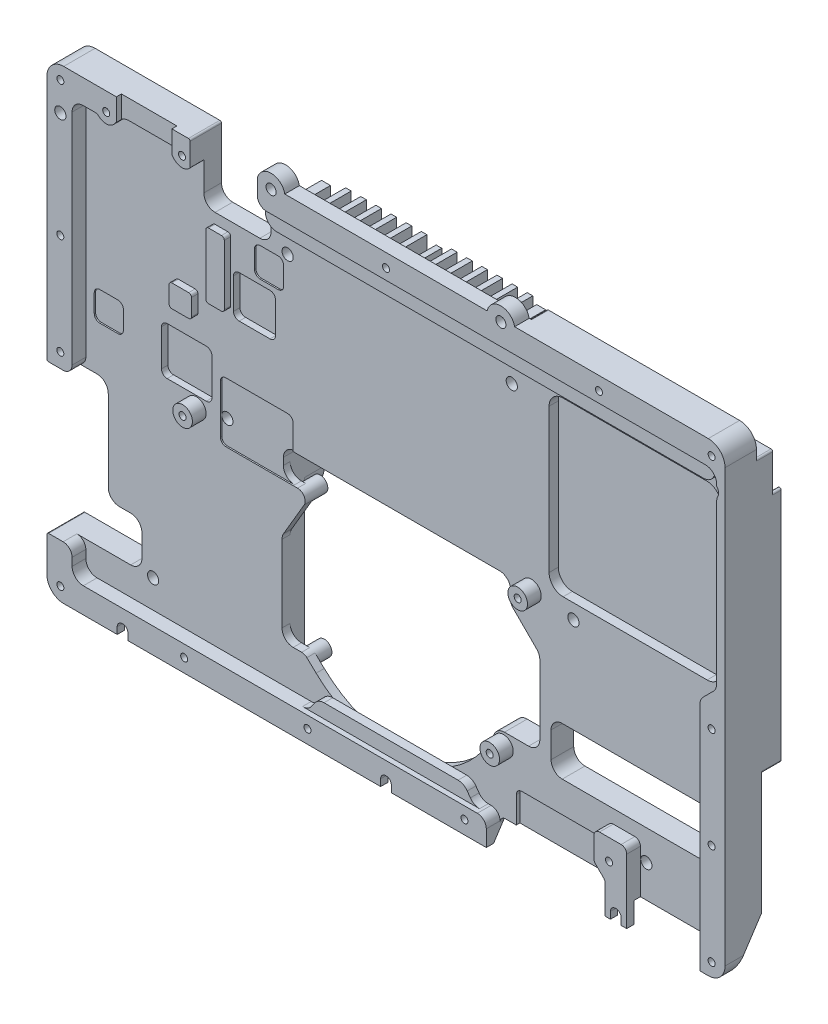
from build123d import *

# Parameters (mm, degrees)
SKIZZE1_W                                           = 121
SKIZZE1_H                                           = 83
AUFSATZ_LINEAR_AUSTRAGEN1_DEPTH                     = 6.5
SKIZZE33_W                                          = 121
SKIZZE33_H                                          = 53.5
AUFSATZ_LINEAR_AUSTRAGEN9_DEPTH                     = 10
SCHNITT_LINEAR_AUSTRAGEN2_DEPTH                     = 106.011915991
SKIZZE9_W                                           = 13.05
SKIZZE9_H                                           = 12.8
SKIZZE9_W_2                                         = 21.2
SKIZZE9_H_2                                         = 14.5
SCHNITT_LINEAR_AUSTRAGEN5_DEPTH                     = 106.011915991
SCHNITT_LINEAR_AUSTRAGEN3_DEPTH                     = 106.216443582
SCHNITT_LINEAR_AUSTRAGEN4_DEPTH                     = 106.011915991
SKIZZE10_W                                          = 9
SKIZZE10_H                                          = 8.5
SKIZZE10_W_2                                        = 7.5
SKIZZE10_H_2                                        = 7.5
SCHNITT_LINEAR_AUSTRAGEN6_DEPTH                     = 105.935504001
SKIZZE79_W                                          = 5.2
SKIZZE79_H                                          = 5.2
SKIZZE79_W_2                                        = 13
SKIZZE79_H_2                                        = 10.649070229
SCHNITT_LINEAR_AUSTRAGEN49_DEPTH                    = 105.994237937
SCHNITT_LINEAR_AUSTRAGEN8_DEPTH                     = 105.906196195
SKIZZE13_W                                          = 29
SKIZZE13_H                                          = 8.6
SCHNITT_LINEAR_AUSTRAGEN9_DEPTH                     = 106.216443582
AUFSATZ_LINEAR_AUSTRAGEN16_REACH                    = 107.216
SKIZZE63_R                                          = 1.85
SKIZZE16_W                                          = 9.9
SKIZZE16_H                                          = 11.306446957
SCHNITT_LINEAR_AUSTRAGEN12_DEPTH                    = 106.134723094
SCHNITT_LINEAR_AUSTRAGEN42_DEPTH                    = 106.011915991
SKIZZE69_W                                          = 1.7
SKIZZE69_H                                          = 8.511092418
SCHNITT_LINEAR_AUSTRAGEN48_DEPTH                    = 75.215497034
LINEARES_MUSTER1_COUNT                              = 7
LINEARES_MUSTER1_PITCH                              = 2.7
SCHNITT_LINEAR_AUSTRAGEN23_DEPTH                    = 105.889751644
SKIZZE41_W                                          = 6.8633937
SKIZZE41_H                                          = 31.095624685
SCHNITT_LINEAR_AUSTRAGEN26_DEPTH                    = 106.084489817
VERRUNDUNG5_R                                       = 2
VERRUNDUNG6_R                                       = 2
SKIZZE58_R                                          = 1.15
AUFSATZ_LINEAR_AUSTRAGEN14_DEPTH                    = 0.5
SPIEGELN1_COPY_1_SKETCH_W                           = 1.7
SPIEGELN1_COPY_1_SKETCH_H                           = 8.511092418
SPIEGELN1_COPY_1_DEPTH                              = 75.215497034
SPIEGELN1_COPY_2_SKETCH_W                           = 1.7
SPIEGELN1_COPY_2_SKETCH_H                           = 8.511092418
SPIEGELN1_COPY_2_DEPTH                              = 75.215497034
SPIEGELN1_COPY_3_SKETCH_W                           = 1.7
SPIEGELN1_COPY_3_SKETCH_H                           = 8.511092418
SPIEGELN1_COPY_3_DEPTH                              = 75.215497034
SPIEGELN1_COPY_4_SKETCH_W                           = 1.7
SPIEGELN1_COPY_4_SKETCH_H                           = 8.511092418
SPIEGELN1_COPY_4_DEPTH                              = 75.215497034
SPIEGELN1_COPY_5_SKETCH_W                           = 1.7
SPIEGELN1_COPY_5_SKETCH_H                           = 8.511092418
SPIEGELN1_COPY_5_DEPTH                              = 75.215497034
SPIEGELN1_COPY_6_SKETCH_W                           = 1.7
SPIEGELN1_COPY_6_SKETCH_H                           = 8.511092418
SPIEGELN1_COPY_6_DEPTH                              = 75.215497034
VERRUNDUNG5_OF_SPIEGELN1_R                          = 2
VERRUNDUNG6_OF_SPIEGELN1_R                          = 2
AUFSATZ_LINEAR_AUSTRAGEN6_REACH                     = 107.216
SKIZZE19_R                                          = 1.75
SCHNITT_LINEAR_AUSTRAGEN15_DEPTH                    = 105.917634361
SCHNITT_LINEAR_AUSTRAGEN25_DEPTH                    = 105.917634361
AUFSATZ_LINEAR_AUSTRAGEN10_REACH                    = 107.216
AUFSATZ_LINEAR_AUSTRAGEN8_DEPTH                     = 2.6
SKIZZE14_W                                          = 12
SKIZZE14_H                                          = 11.5
SCHNITT_LINEAR_AUSTRAGEN10_DEPTH                    = 107.848022911
SCHNITT_LINEAR_AUSTRAGEN45_DEPTH                    = 107.636110207
SCHNITT_LINEAR_AUSTRAGEN20_DEPTH                    = 107.636110207
SKIZZE32_R                                          = 0.9
SCHNITT_LINEAR_AUSTRAGEN21_DEPTH                    = 107.848022911
AUFSATZ_LINEAR_AUSTRAGEN7_REACH                     = 108.577
SKIZZE26_R                                          = 1.35
AUFSATZ_LINEAR_AUSTRAGEN11_REACH                    = 108.734
SKIZZE39_W                                          = 4
SKIZZE39_H                                          = 4
AUFSATZ_LINEAR_AUSTRAGEN12_REACH                    = 108.734
SKIZZE40_W                                          = 3.3
SKIZZE40_H                                          = 11.7
SKIZZE59_W                                          = 40
SKIZZE59_H                                          = 25.954856241
SCHNITT_LINEAR_AUSTRAGEN40_DEPTH                    = 107.802387614
SCHNITT_LINEAR_AUSTRAGEN28_DEPTH                    = 107.967004258
SCHNITT_LINEAR_AUSTRAGEN28_DEPTH_BACK               = 107.967004258
SCHNITT_LINEAR_AUSTRAGEN29_DEPTH                    = 107.848022911
SKIZZE45_W                                          = 38.1
SKIZZE45_H                                          = 5.324170816
SCHNITT_LINEAR_AUSTRAGEN30_DEPTH                    = 107.734202578
SKIZZE48_W                                          = 15.4
SKIZZE48_H                                          = 12
SCHNITT_LINEAR_AUSTRAGEN33_DEPTH                    = 107.602579706
AUFSATZ_LINEAR_AUSTRAGEN13_DEPTH                    = 1.55
SCHNITT_LINEAR_START                                = -6.5
SCHNITT_LINEAR_AUSTRAGEN44_DEPTH                    = 101.348022911
SKIZZE80_W                                          = 81.949489743
SKIZZE80_H                                          = 3.7
AUFSATZ_LINEAR_AUSTRAGEN17_DEPTH                    = 1
VERRUNDUNG1_R                                       = 3
VERRUNDUNG4_R                                       = 2
VERRUNDUNG8_R                                       = 2
VERRUNDUNG9_R                                       = 2
VERRUNDUNG16_R                                      = 1
VERRUNDUNG13_R                                      = 1
VERRUNDUNG14_R                                      = 15
VERRUNDUNG17_R                                      = 0.5
M1_6_GEWINDEBOHRUNG1_D                              = 1.25
SKIZZE64_R                                          = 1.25
SCHNITT_LINEAR_AUSTRAGEN43_DEPTH                    = 107.646624419
F_2_0_2_DURCHMESSER_BOHRUNG3_D                      = 2
F_2_0_2_DURCHMESSER_BOHRUNG3_DEPTH                  = 8.7
F_2_0_2_DURCHMESSER_BOHRUNG3_TIP                    = 0.600860619
F_2_0_2_DURCHMESSER_BOHRUNG4_D                      = 2
F_2_0_2_DURCHMESSER_BOHRUNG4_DEPTH                  = 6
F_2_0_2_DURCHMESSER_BOHRUNG4_TIP                    = 0.600860619
F_2_0_2_DURCHMESSER_BOHRUNG5_D                      = 2
F_2_0_2_DURCHMESSER_BOHRUNG5_DEPTH                  = 4
F_2_0_2_DURCHMESSER_BOHRUNG5_TIP                    = 0.600860619
VERRUNDUNG18_R                                      = 2
VERRUNDUNG19_R                                      = 5
VERRUNDUNG20_R                                      = 1
VERRUNDUNG21_R                                      = 0.3
VERRUNDUNG22_R                                      = 0.3
FASE1_SIZE                                          = 0.3
FASE1_SIZE2                                         = 0.519615242
SCHNITT_LINEAR_AUSTRAGEN50_DEPTH                    = 10
VERRUNDUNG23_R                                      = 1.6
FORMSENKUNG_F_R_M1_6_LINSENSENKSCHRAUBE_D           = 1.8
FORMSENKUNG_F_R_M1_6_LINSENSENKSCHRAUBE_CSINK_D     = 3.8
FORMSENKUNG_F_R_M1_6_LINSENSENKSCHRAUBE_CSINK_ANGLE = 90


with BuildPart() as part:
    # Skizze1 → Aufsatz-Linear austragen1 (new body)
    with BuildSketch(Plane.XY.offset(11.2)):
        with Locations((0, 44)):
            Rectangle(SKIZZE1_W, SKIZZE1_H)
    extrude(amount=-AUFSATZ_LINEAR_AUSTRAGEN1_DEPTH)

    # Skizze33 → Aufsatz-Linear austragen9 (add)
    with BuildSketch(Plane.XY.offset(11.2)):
        with Locations((0, 58.75)):
            Rectangle(SKIZZE33_W, SKIZZE33_H)
    extrude(amount=-AUFSATZ_LINEAR_AUSTRAGEN9_DEPTH)

    # Skizze6 → Schnitt-Linear austragen2 (cut, through all)
    with BuildSketch(Plane.XY.offset(8.75)):
        Polygon((56, 7), (-56, 7), (-56, 81.2), (59, 81.2), (59, 47.5), (56, 44.5), align=None)
    extrude(amount=SCHNITT_LINEAR_AUSTRAGEN2_DEPTH, mode=Mode.SUBTRACT)

    # Skizze9 → Schnitt-Linear austragen5 (cut, through all)
    with BuildSketch(Plane.XY.offset(8.75)):
        with Locations((49.475, 8.9)):
            Rectangle(SKIZZE9_W, SKIZZE9_H)
        with Locations((28.5, 9.75)):
            Rectangle(SKIZZE9_W_2, SKIZZE9_H_2)
    extrude(amount=SCHNITT_LINEAR_AUSTRAGEN5_DEPTH, mode=Mode.SUBTRACT)

    # Skizze7 → Schnitt-Linear austragen3 (cut, through all)
    with BuildSketch(Plane.XY.offset(11.2)):
        Polygon((-46, 12), (-60.5, 12), (-60.5, 38.5), (-52, 38.5), (-52, 20), (-46, 20), align=None)
    extrude(amount=-SCHNITT_LINEAR_AUSTRAGEN3_DEPTH, mode=Mode.SUBTRACT)

    # Skizze8 → Schnitt-Linear austragen4 (cut, through all)
    with BuildSketch(Plane.XY.offset(8.75)):
        with BuildLine():
            Line((19.809445626, 44), (19.809445626, 40.411798112))
            ThreePointArc((19.809445626, 40.411798112), (19.912208257, 39.895175478), (20.204851471, 39.457203957))
            Line((20.204851471, 39.457203957), (25, 34.662055429))
            Line((25, 34.662055429), (25, 19.5))
            Line((25, 19.5), (17.331961786, 19.5))
            ThreePointArc((17.331961786, 19.5), (3.288012842, 6.938895718), (-14.91063478, 11.819783698))
            Line((-14.91063478, 11.819783698), (-16.566801389, 13.387317758))
            ThreePointArc((-16.566801389, 13.387317758), (-16.995366309, 13.661068052), (-17.494799215, 13.756848465))
            Line((-17.494799215, 13.756848465), (-21, 13.756848465))
            Line((-21, 13.756848465), (-21, 30))
            Line((-21, 30), (-17.058608218, 36.717771467))
            ThreePointArc((-17.058608218, 36.717771467), (-17.051507179, 38.071838218), (-18.222994207, 38.750929771))
            Line((-18.222994207, 38.750929771), (-21, 38.750929771))
            Line((-21, 38.750929771), (-21, 44))
            Line((-21, 44), (19.809445626, 44))
        make_face()
    extrude(amount=-SCHNITT_LINEAR_AUSTRAGEN4_DEPTH, mode=Mode.SUBTRACT)

    # Skizze10 → Schnitt-Linear austragen6 (cut, through all)
    with BuildSketch(Plane.XY.offset(7.6)):
        with Locations((-38, 48.3)):
            Rectangle(SKIZZE10_W, SKIZZE10_H)
        with Locations((-25.9, 63.1)):
            Rectangle(SKIZZE10_W_2, SKIZZE10_H_2)
    extrude(amount=SCHNITT_LINEAR_AUSTRAGEN6_DEPTH, mode=Mode.SUBTRACT)

    # Skizze79 → Schnitt-Linear austragen49 (cut, through all)
    with BuildSketch(Plane.XY.offset(8.5)):
        with Locations((-51.9, 49.2)):
            Rectangle(SKIZZE79_W, SKIZZE79_H)
        with Locations((-25.5, 44.075464886)):
            Rectangle(SKIZZE79_W_2, SKIZZE79_H_2)
        with Locations((-23.3, 70.3)):
            Rectangle(SKIZZE79_W, SKIZZE79_H)
    extrude(amount=SCHNITT_LINEAR_AUSTRAGEN49_DEPTH, mode=Mode.SUBTRACT)

    # Skizze12 → Schnitt-Linear austragen8 (cut, through all)
    with BuildSketch(Plane.XY.offset(7.1)):
        with BuildLine():
            Line((54.85, 76.35), (29.15, 76.35))
            ThreePointArc((29.15, 76.35), (27.382233047, 75.617766953), (26.65, 73.85))
            Line((26.65, 73.85), (26.65, 48.15))
            ThreePointArc((26.65, 48.15), (27.382233047, 46.382233047), (29.15, 45.65))
            Line((29.15, 45.65), (54.85, 45.65))
            ThreePointArc((54.85, 45.65), (56.617766953, 46.382233047), (57.35, 48.15))
            Line((57.35, 48.15), (57.35, 73.85))
            ThreePointArc((57.35, 73.85), (56.617766953, 75.617766953), (54.85, 76.35))
        make_face()
    extrude(amount=SCHNITT_LINEAR_AUSTRAGEN8_DEPTH, mode=Mode.SUBTRACT)

    # Skizze13 → Schnitt-Linear austragen9 (cut, through all)
    with BuildSketch(Plane.XY.offset(11.2)):
        with Locations((41.5, 21.7)):
            Rectangle(SKIZZE13_W, SKIZZE13_H)
    extrude(amount=-SCHNITT_LINEAR_AUSTRAGEN9_DEPTH, mode=Mode.SUBTRACT)

    # Skizze63 → Aufsatz-Linear austragen16 (add, up to next)
    with BuildSketch(Plane.XY.offset(11.2), mode=Mode.PRIVATE) as aufsatz_linear_austragen16_sk1:
        with Locations((-49.930000351, 82.264999958)):
            Circle(SKIZZE63_R)
    aufsatz_linear_austragen16_tool1 = extrude(aufsatz_linear_austragen16_sk1.sketch, amount=-AUFSATZ_LINEAR_AUSTRAGEN16_REACH, mode=Mode.PRIVATE) - part.part
    # Skizze63 → Aufsatz-Linear austragen16 (add, up to next)
    with BuildSketch(Plane.XY.offset(11.2), mode=Mode.PRIVATE) as aufsatz_linear_austragen16_sk2:
        with Locations((-36.410001, 82.25496)):
            Circle(SKIZZE63_R)
    aufsatz_linear_austragen16_tool2 = extrude(aufsatz_linear_austragen16_sk2.sketch, amount=-AUFSATZ_LINEAR_AUSTRAGEN16_REACH, mode=Mode.PRIVATE) - part.part
    add(aufsatz_linear_austragen16_tool1.solids().sort_by_distance((-49.93, 82.265, 11.2))[0])
    add(aufsatz_linear_austragen16_tool2.solids().sort_by_distance((-36.410001, 82.25496, 11.2))[0])

    # Skizze16 → Schnitt-Linear austragen12 (cut, through all)
    with BuildSketch(Plane.XY.offset(10.3)):
        with Locations((-43.15, 84.036818133)):
            Rectangle(SKIZZE16_W, SKIZZE16_H)
    extrude(amount=SCHNITT_LINEAR_AUSTRAGEN12_DEPTH, mode=Mode.SUBTRACT)

    # Skizze62 → Schnitt-Linear austragen42 (cut, through all)
    with BuildSketch(Plane.XY.offset(8.75)):
        with BuildLine():
            Line((-48.41729579, 81.2), (-37.926090633, 81.194784437))
            ThreePointArc((-37.926090633, 81.194784437), (-38.641058696, 81.822383664), (-39.565106453, 82.048648694))
            Line((-39.565106453, 82.048648694), (-46.781939508, 82.048648694))
            ThreePointArc((-46.781939508, 82.048648694), (-47.703160814, 81.823853275), (-48.41729579, 81.2))
        make_face()
    extrude(amount=SCHNITT_LINEAR_AUSTRAGEN42_DEPTH, mode=Mode.SUBTRACT)

    # Skizze69 → Schnitt-Linear austragen48 (cut, through all)
    with BuildSketch(Plane(origin=(0, 44, 0), x_dir=(1, 0, 0), z_dir=(0, 1, 0))):
        with Locations((1.35, -3.244453791)):
            Rectangle(SKIZZE69_W, SKIZZE69_H)
    schnitt_linear_austragen48 = extrude(amount=SCHNITT_LINEAR_AUSTRAGEN48_DEPTH, mode=Mode.SUBTRACT)

    # Lineares Muster1: Schnitt-Linear austragen48 ×7
    with Locations(*[(i * LINEARES_MUSTER1_PITCH, 0, 0) for i in range(1, LINEARES_MUSTER1_COUNT)]):
        add(schnitt_linear_austragen48, mode=Mode.SUBTRACT)

    # Skizze35 → Schnitt-Linear austragen23 (cut, through all)
    with BuildSketch(Plane.XY.offset(5.6)):
        with BuildLine():
            Line((56.5, 81), (56.5, 47.5))
            Line((56.5, 47.5), (20, 47.5))
            Line((20, 47.5), (20, 71.3))
            ThreePointArc((20, 71.3), (22.7, 74), (20, 76.7))
            Line((20, 76.7), (20, 85.5))
            Line((20, 85.5), (60.5, 85.5))
            Line((60.5, 85.5), (60.5, 81))
            Line((60.5, 81), (56.5, 81))
        make_face()
    schnitt_linear_austragen23 = extrude(amount=-SCHNITT_LINEAR_AUSTRAGEN23_DEPTH, mode=Mode.SUBTRACT)

    # Skizze41 → Schnitt-Linear austragen26 (cut, through all)
    with BuildSketch(Plane(origin=(0, 0, 2.7), x_dir=(-1, 0, 0), z_dir=(0, 0, -1))):
        with Locations((-21.83169685, 78.147812343)):
            Rectangle(SKIZZE41_W, SKIZZE41_H)
        Polygon((-60.5, 89.861679467), (-56.5, 89.861679467), (-56.5, 70.75), (-60.5, 74.75), align=None)
        with BuildLine():
            Line((-37.350852961, 47.5), (-33.814582562, 41.375))
            ThreePointArc((-33.814582562, 41.375), (-30.158838103, 39.860741065), (-27.75, 43))
            Line((-27.75, 43), (-27.75, 47.5))
            Line((-27.75, 47.5), (-37.350852961, 47.5))
        make_face()
    schnitt_linear_austragen26 = extrude(amount=SCHNITT_LINEAR_AUSTRAGEN26_DEPTH, mode=Mode.SUBTRACT)

    # Verrundung5
    verrundung5_edges = [part.edges().sort_by_distance(p)[0] for p in [
        (20, 47.5, 3.4),
        (56.5, 47.5, 3.4),
    ]]
    fillet(verrundung5_edges, radius=VERRUNDUNG5_R)

    # Verrundung6
    verrundung6_edges = [part.edges().sort_by_distance(p)[0] for p in [
        (20, 76.7, 4.15),
        (20, 71.3, 4.15),
    ]]
    fillet(verrundung6_edges, radius=VERRUNDUNG6_R)

    # Skizze58 → Aufsatz-Linear austragen14 (add)
    with BuildSketch(Plane.XY.offset(5.6)):
        with Locations((53.5, 50.5)):
            Circle(SKIZZE58_R)
        with Locations((39, 79)):
            Circle(SKIZZE58_R)
    aufsatz_linear_austragen14 = extrude(amount=-AUFSATZ_LINEAR_AUSTRAGEN14_DEPTH)

    # Spiegeln1: Schnitt-Linear austragen48, Schnitt-Linear austragen23, Schnitt-Linear austragen26, Aufsatz-Linear austragen14 across plane
    add(schnitt_linear_austragen48.mirror(Plane(origin=(0, 0, 0), x_dir=(0, 0, 1), z_dir=(1, 0, 0))), mode=Mode.SUBTRACT)
    add(schnitt_linear_austragen23.mirror(Plane(origin=(0, 0, 0), x_dir=(0, 0, 1), z_dir=(1, 0, 0))), mode=Mode.SUBTRACT)
    add(schnitt_linear_austragen26.mirror(Plane(origin=(0, 0, 0), x_dir=(0, 0, 1), z_dir=(1, 0, 0))), mode=Mode.SUBTRACT)
    add(aufsatz_linear_austragen14.mirror(Plane(origin=(0, 0, 0), x_dir=(0, 0, 1), z_dir=(1, 0, 0))))

    # Spiegeln1 copy 1 sketch → Spiegeln1 copy 1 (cut, through all)
    with BuildSketch(Plane(origin=(-2.7, 44, 0), x_dir=(-1, 0, 0), z_dir=(0, 1, 0))):
        with Locations((1.35, 3.244453791)):
            Rectangle(SPIEGELN1_COPY_1_SKETCH_W, SPIEGELN1_COPY_1_SKETCH_H)
    extrude(amount=SPIEGELN1_COPY_1_DEPTH, mode=Mode.SUBTRACT)

    # Spiegeln1 copy 2 sketch → Spiegeln1 copy 2 (cut, through all)
    with BuildSketch(Plane(origin=(-5.4, 44, 0), x_dir=(-1, 0, 0), z_dir=(0, 1, 0))):
        with Locations((1.35, 3.244453791)):
            Rectangle(SPIEGELN1_COPY_2_SKETCH_W, SPIEGELN1_COPY_2_SKETCH_H)
    extrude(amount=SPIEGELN1_COPY_2_DEPTH, mode=Mode.SUBTRACT)

    # Spiegeln1 copy 3 sketch → Spiegeln1 copy 3 (cut, through all)
    with BuildSketch(Plane(origin=(-8.1, 44, 0), x_dir=(-1, 0, 0), z_dir=(0, 1, 0))):
        with Locations((1.35, 3.244453791)):
            Rectangle(SPIEGELN1_COPY_3_SKETCH_W, SPIEGELN1_COPY_3_SKETCH_H)
    extrude(amount=SPIEGELN1_COPY_3_DEPTH, mode=Mode.SUBTRACT)

    # Spiegeln1 copy 4 sketch → Spiegeln1 copy 4 (cut, through all)
    with BuildSketch(Plane(origin=(-10.8, 44, 0), x_dir=(-1, 0, 0), z_dir=(0, 1, 0))):
        with Locations((1.35, 3.244453791)):
            Rectangle(SPIEGELN1_COPY_4_SKETCH_W, SPIEGELN1_COPY_4_SKETCH_H)
    extrude(amount=SPIEGELN1_COPY_4_DEPTH, mode=Mode.SUBTRACT)

    # Spiegeln1 copy 5 sketch → Spiegeln1 copy 5 (cut, through all)
    with BuildSketch(Plane(origin=(-13.5, 44, 0), x_dir=(-1, 0, 0), z_dir=(0, 1, 0))):
        with Locations((1.35, 3.244453791)):
            Rectangle(SPIEGELN1_COPY_5_SKETCH_W, SPIEGELN1_COPY_5_SKETCH_H)
    extrude(amount=SPIEGELN1_COPY_5_DEPTH, mode=Mode.SUBTRACT)

    # Spiegeln1 copy 6 sketch → Spiegeln1 copy 6 (cut, through all)
    with BuildSketch(Plane(origin=(-16.2, 44, 0), x_dir=(-1, 0, 0), z_dir=(0, 1, 0))):
        with Locations((1.35, 3.244453791)):
            Rectangle(SPIEGELN1_COPY_6_SKETCH_W, SPIEGELN1_COPY_6_SKETCH_H)
    extrude(amount=SPIEGELN1_COPY_6_DEPTH, mode=Mode.SUBTRACT)

    # Verrundung5 of Spiegeln1
    verrundung5_of_spiegeln1_edges = [part.edges().sort_by_distance(p)[0] for p in [
        (-20, 47.5, 3.4),
        (-56.5, 47.5, 3.4),
    ]]
    fillet(verrundung5_of_spiegeln1_edges, radius=VERRUNDUNG5_OF_SPIEGELN1_R)

    # Verrundung6 of Spiegeln1
    verrundung6_of_spiegeln1_edges = [part.edges().sort_by_distance(p)[0] for p in [
        (-20, 76.7, 4.15),
        (-20, 71.3, 4.15),
    ]]
    fillet(verrundung6_of_spiegeln1_edges, radius=VERRUNDUNG6_OF_SPIEGELN1_R)

    # Skizze19 → Aufsatz-Linear austragen6 (add, up to next)
    with BuildSketch(Plane.XY.offset(11.2), mode=Mode.PRIVATE) as aufsatz_linear_austragen6_sk1:
        with Locations((23.5, 43.8)):
            Circle(SKIZZE19_R)
    aufsatz_linear_austragen6_tool1 = extrude(aufsatz_linear_austragen6_sk1.sketch, amount=-AUFSATZ_LINEAR_AUSTRAGEN6_REACH, mode=Mode.PRIVATE) - part.part
    # Skizze19 → Aufsatz-Linear austragen6 (add, up to next)
    with BuildSketch(Plane.XY.offset(11.2), mode=Mode.PRIVATE) as aufsatz_linear_austragen6_sk2:
        with Locations((-36.29, 42.1)):
            Circle(SKIZZE19_R)
    aufsatz_linear_austragen6_tool2 = extrude(aufsatz_linear_austragen6_sk2.sketch, amount=-AUFSATZ_LINEAR_AUSTRAGEN6_REACH, mode=Mode.PRIVATE) - part.part
    # Skizze19 → Aufsatz-Linear austragen6 (add, up to next)
    with BuildSketch(Plane.XY.offset(11.2), mode=Mode.PRIVATE) as aufsatz_linear_austragen6_sk3:
        with Locations((18.51, 17.3)):
            Circle(SKIZZE19_R)
    aufsatz_linear_austragen6_tool3 = extrude(aufsatz_linear_austragen6_sk3.sketch, amount=-AUFSATZ_LINEAR_AUSTRAGEN6_REACH, mode=Mode.PRIVATE) - part.part
    add(aufsatz_linear_austragen6_tool1.solids().sort_by_distance((23.5, 43.8, 11.2))[0])
    add(aufsatz_linear_austragen6_tool2.solids().sort_by_distance((-36.29, 42.1, 11.2))[0])
    add(aufsatz_linear_austragen6_tool3.solids().sort_by_distance((18.51, 17.3, 11.2))[0])

    # Skizze24 → Schnitt-Linear austragen15 (cut, through all)
    with BuildSketch(Plane.XY.offset(7.3)):
        Polygon((-21, 2.5), (11, 2.5), (11, 19.5), (25, 19.5), (25, 44), (-21, 44), align=None)
    extrude(amount=-SCHNITT_LINEAR_AUSTRAGEN15_DEPTH, mode=Mode.SUBTRACT)

    # Skizze37 → Schnitt-Linear austragen25 (cut, through all)
    with BuildSketch(Plane.XY.offset(7.3)):
        with BuildLine():
            Line((25.267766953, 42.032233047), (20.875617345, 37.640083439))
            ThreePointArc((20.875617345, 37.640083439), (17.340083439, 37.640083439), (17.340083439, 41.175617345))
            Line((17.340083439, 41.175617345), (21.732233047, 45.567766953))
            ThreePointArc((21.732233047, 45.567766953), (25.267766953, 45.567766953), (25.267766953, 42.032233047))
        make_face()
    extrude(amount=-SCHNITT_LINEAR_AUSTRAGEN25_DEPTH, mode=Mode.SUBTRACT)

    # Skizze38 → Aufsatz-Linear austragen10 (add, up to next)
    with BuildSketch(Plane.XY.offset(11.2), mode=Mode.PRIVATE) as aufsatz_linear_austragen10_sk1:
        Polygon((39.1, 2.5), (39.1, 8), (37.1, 10), (37.1, 15), (42.95, 15), (42.95, 2.5), align=None)
    aufsatz_linear_austragen10_tool1 = extrude(aufsatz_linear_austragen10_sk1.sketch, amount=-AUFSATZ_LINEAR_AUSTRAGEN10_REACH, mode=Mode.PRIVATE) - part.part
    add(aufsatz_linear_austragen10_tool1.solids().sort_by_distance((40.452304, 9.393105, 11.2))[0])

    # Skizze30 → Aufsatz-Linear austragen8 (add)
    with BuildSketch(Plane.XY.offset(11.2)):
        with BuildLine():
            Line((23, 84), (23, 85))
            ThreePointArc((23, 85), (20.5, 87.5), (18, 85))
            Line((18, 85), (18, 84))
            Line((18, 84), (23, 84))
        make_face()
        with BuildLine():
            Line((-18, 84), (-23, 84))
            Line((-23, 84), (-23, 85))
            ThreePointArc((-23, 85), (-20.5, 87.5), (-18, 85))
            Line((-18, 85), (-18, 84))
        make_face()
    extrude(amount=-AUFSATZ_LINEAR_AUSTRAGEN8_DEPTH)

    # Skizze14 → Schnitt-Linear austragen10 (cut, through all)
    with BuildSketch(Plane.XY.offset(11.2)):
        with Locations((-28.949489743, 79.75)):
            Rectangle(SKIZZE14_W, SKIZZE14_H)
    extrude(amount=-SCHNITT_LINEAR_AUSTRAGEN10_DEPTH, mode=Mode.SUBTRACT)

    # Skizze66 → Schnitt-Linear austragen45 (cut, through all)
    with BuildSketch(Plane.XY.offset(8.6)):
        with BuildLine():
            Line((-1.5, 83.1), (-1.5, 91.325807586))
            ThreePointArc((-1.5, 91.325807586), (0, 92.825807586), (1.5, 91.325807586))
            Line((1.5, 91.325807586), (1.5, 83.1))
            ThreePointArc((1.5, 83.1), (0, 81.6), (-1.5, 83.1))
        make_face()
    extrude(amount=-SCHNITT_LINEAR_AUSTRAGEN45_DEPTH, mode=Mode.SUBTRACT)

    # Skizze31 → Schnitt-Linear austragen20 (cut, through all)
    with BuildSketch(Plane.XY.offset(8.6)):
        with BuildLine():
            Line((-22.949489743, 82.4), (-22.949489743, 87.6))
            Line((-22.949489743, 87.6), (20.5, 87.6))
            ThreePointArc((20.5, 87.6), (23.1, 85), (20.5, 82.4))
            Line((20.5, 82.4), (-22.949489743, 82.4))
        make_face()
    extrude(amount=-SCHNITT_LINEAR_AUSTRAGEN20_DEPTH, mode=Mode.SUBTRACT)

    # Skizze32 → Schnitt-Linear austragen21 (cut, through all)
    with BuildSketch(Plane.XY.offset(11.2)):
        with Locations((20.5, 85)):
            Circle(SKIZZE32_R)
        with Locations((-20.5, 85)):
            Circle(SKIZZE32_R)
    extrude(amount=-SCHNITT_LINEAR_AUSTRAGEN21_DEPTH, mode=Mode.SUBTRACT)

    # Skizze26 → Aufsatz-Linear austragen7 (add, up to next)
    with BuildSketch(Plane.XY.offset(4.7), mode=Mode.PRIVATE) as aufsatz_linear_austragen7_sk1:
        with Locations((-18.222994207, 37.400929771)):
            Circle(SKIZZE26_R)
    aufsatz_linear_austragen7_tool1 = extrude(aufsatz_linear_austragen7_sk1.sketch, amount=AUFSATZ_LINEAR_AUSTRAGEN7_REACH, mode=Mode.PRIVATE) - part.part
    # Skizze26 → Aufsatz-Linear austragen7 (add, up to next)
    with BuildSketch(Plane.XY.offset(4.7), mode=Mode.PRIVATE) as aufsatz_linear_austragen7_sk2:
        with Locations((21.159445626, 40.411798112)):
            Circle(SKIZZE26_R)
    aufsatz_linear_austragen7_tool2 = extrude(aufsatz_linear_austragen7_sk2.sketch, amount=AUFSATZ_LINEAR_AUSTRAGEN7_REACH, mode=Mode.PRIVATE) - part.part
    # Skizze26 → Aufsatz-Linear austragen7 (add, up to next)
    with BuildSketch(Plane.XY.offset(4.7), mode=Mode.PRIVATE) as aufsatz_linear_austragen7_sk3:
        with Locations((-17.494799215, 12.406848465)):
            Circle(SKIZZE26_R)
    aufsatz_linear_austragen7_tool3 = extrude(aufsatz_linear_austragen7_sk3.sketch, amount=AUFSATZ_LINEAR_AUSTRAGEN7_REACH, mode=Mode.PRIVATE) - part.part
    add(aufsatz_linear_austragen7_tool1.solids().sort_by_distance((-18.222994, 37.40093, 4.7))[0])
    add(aufsatz_linear_austragen7_tool2.solids().sort_by_distance((21.159446, 40.411798, 4.7))[0])
    add(aufsatz_linear_austragen7_tool3.solids().sort_by_distance((-17.494799, 12.406848, 4.7))[0])

    # Skizze39 → Aufsatz-Linear austragen11 (add, up to next)
    with BuildSketch(Plane.XY.offset(9.9), mode=Mode.PRIVATE) as aufsatz_linear_austragen11_sk1:
        with Locations((-38, 58.4)):
            Rectangle(SKIZZE39_W, SKIZZE39_H)
    aufsatz_linear_austragen11_tool1 = extrude(aufsatz_linear_austragen11_sk1.sketch, amount=-AUFSATZ_LINEAR_AUSTRAGEN11_REACH, mode=Mode.PRIVATE) - part.part
    add(aufsatz_linear_austragen11_tool1.solids().sort_by_distance((-38, 58.4, 9.9))[0])

    # Skizze40 → Aufsatz-Linear austragen12 (add, up to next)
    with BuildSketch(Plane.XY.offset(9.9), mode=Mode.PRIVATE) as aufsatz_linear_austragen12_sk1:
        with Locations((-31.8, 66.3)):
            Rectangle(SKIZZE40_W, SKIZZE40_H)
    aufsatz_linear_austragen12_tool1 = extrude(aufsatz_linear_austragen12_sk1.sketch, amount=-AUFSATZ_LINEAR_AUSTRAGEN12_REACH, mode=Mode.PRIVATE) - part.part
    add(aufsatz_linear_austragen12_tool1.solids().sort_by_distance((-31.8, 66.3, 9.9))[0])

    # Skizze59 → Schnitt-Linear austragen40 (cut, through all)
    with BuildSketch(Plane.XY.offset(1.7)):
        with Locations((0, 75.577428121)):
            Rectangle(SKIZZE59_W, SKIZZE59_H)
    extrude(amount=-SCHNITT_LINEAR_AUSTRAGEN40_DEPTH, mode=Mode.SUBTRACT)

    # Skizze43 → Schnitt-Linear austragen28 (cut, two sides: drawn at the far end of the back side and taken through both)
    with BuildSketch(Plane(origin=(0, 0, 0), x_dir=(0, 0, -1), z_dir=(1, 0, 0)).offset(-SCHNITT_LINEAR_AUSTRAGEN28_DEPTH_BACK)):
        Polygon((-4.7, 10.4), (-9.9, 2.5), (-4.7, 2.5), align=None)
    extrude(amount=SCHNITT_LINEAR_AUSTRAGEN28_DEPTH + SCHNITT_LINEAR_AUSTRAGEN28_DEPTH_BACK, mode=Mode.SUBTRACT)

    # Skizze44 → Schnitt-Linear austragen29 (cut, through all)
    with BuildSketch(Plane.XY.offset(11.2)):
        with BuildLine():
            Line((-46.05, 3.7), (-46.05, 1.237554177))
            ThreePointArc((-46.05, 1.237554177), (-47, 0.287554177), (-47.95, 1.237554177))
            Line((-47.95, 1.237554177), (-47.95, 3.7))
            ThreePointArc((-47.95, 3.7), (-47, 4.65), (-46.05, 3.7))
        make_face()
        with BuildLine():
            Line((0.95, 3.7), (0.95, 1.849611943))
            ThreePointArc((0.95, 1.849611943), (0, 0.899611943), (-0.95, 1.849611943))
            Line((-0.95, 1.849611943), (-0.95, 3.7))
            ThreePointArc((-0.95, 3.7), (0, 4.65), (0.95, 3.7))
        make_face()
        with BuildLine():
            Line((41.95, 3.7), (41.95, 1.637537601))
            ThreePointArc((41.95, 1.637537601), (41, 0.687537601), (40.05, 1.637537601))
            Line((40.05, 1.637537601), (40.05, 3.7))
            ThreePointArc((40.05, 3.7), (41, 4.65), (41.95, 3.7))
        make_face()
    extrude(amount=-SCHNITT_LINEAR_AUSTRAGEN29_DEPTH, mode=Mode.SUBTRACT)

    # Skizze45 → Schnitt-Linear austragen30 (cut, through all)
    with BuildSketch(Plane.XY.offset(9.9)):
        with BuildLine():
            Line((-45.1, 3.7), (-45.1, 0.716566229))
            ThreePointArc((-45.1, 0.716566229), (-47, -1.183433771), (-48.9, 0.716566229))
            Line((-48.9, 0.716566229), (-48.9, 3.7))
            ThreePointArc((-48.9, 3.7), (-47, 5.6), (-45.1, 3.7))
        make_face()
        with BuildLine():
            Line((1.9, 3.7), (1.9, 0.875829184))
            ThreePointArc((1.9, 0.875829184), (0, -1.024170816), (-1.9, 0.875829184))
            Line((-1.9, 0.875829184), (-1.9, 3.7))
            ThreePointArc((-1.9, 3.7), (0, 5.6), (1.9, 3.7))
        make_face()
        with Locations((36.95, 3.537914592)):
            Rectangle(SKIZZE45_W, SKIZZE45_H)
    extrude(amount=-SCHNITT_LINEAR_AUSTRAGEN30_DEPTH, mode=Mode.SUBTRACT)

    # Skizze48 → Schnitt-Linear austragen33 (cut, through all)
    with BuildSketch(Plane.XY.offset(8.1)):
        with Locations((28.5, 5.9)):
            Rectangle(SKIZZE48_W, SKIZZE48_H)
    extrude(amount=SCHNITT_LINEAR_AUSTRAGEN33_DEPTH, mode=Mode.SUBTRACT)

    # Skizze57 → Aufsatz-Linear austragen13 (add)
    with BuildSketch(Plane.XY.offset(10.3)):
        Polygon((-14.75, 7), (14.75, 7), (13, 9.5), (-13, 9.5), align=None)
    extrude(amount=-AUFSATZ_LINEAR_AUSTRAGEN13_DEPTH)

    # Skizze65 → Schnitt-Linear austragen44 (cut, through all)
    with BuildSketch(Plane.XY.offset(11.2).offset(SCHNITT_LINEAR_START)):
        Polygon((-37.741669751, 32), (-49, 38.5), (-60.5, 38.5), (-60.5, 32), (-49, 32), align=None)
    extrude(amount=-SCHNITT_LINEAR_AUSTRAGEN44_DEPTH, mode=Mode.SUBTRACT)

    # Skizze80 → Aufsatz-Linear austragen17 (add)
    with BuildSketch(Plane.XY.offset(8.75)):
        with Locations((18.025255129, 79.35)):
            Rectangle(SKIZZE80_W, SKIZZE80_H)
    extrude(amount=AUFSATZ_LINEAR_AUSTRAGEN17_DEPTH)

    # Verrundung1
    verrundung1_edges = [part.edges().sort_by_distance(p)[0] for p in [
        (-60.5, 2.5, 10.55),
        (60.5, 2.5, 10.55),
        (60.5, 85.5, 8.4),
        (-60.5, 85.5, 8.4),
    ]]
    fillet(verrundung1_edges, radius=VERRUNDUNG1_R)

    # Verrundung4
    # the kernel refuses this fillet: 2 mm, written as the material it adds along each edge
    with BuildSketch(Plane(origin=(19.809445626, 44, 8.75), x_dir=(-1, 0, 0), z_dir=(0, 0, -1))) as verrundung4_piece_1_section:
        with BuildLine():
            CenterArc((VERRUNDUNG4_R, -VERRUNDUNG4_R), VERRUNDUNG4_R, 90, 90)
            Line((0, -VERRUNDUNG4_R), (0, 0))
            Line((0, 0), (VERRUNDUNG4_R, 0))
        make_face()
    verrundung4_piece_1 = extrude(amount=6.45, mode=Mode.PRIVATE)
    verrundung4_piece_1 = split(verrundung4_piece_1, bisect_by=Plane(origin=(18.253027711, 43.973352426, 7.5), z_dir=(0, 0, 1)), keep=Keep.TOP, mode=Mode.PRIVATE)
    add(verrundung4_piece_1)
    with BuildSketch(Plane(origin=(19.809445626, 44, 13.75), x_dir=(-1, 0, 0), z_dir=(0, 0, -1))) as verrundung4_piece_2_section:
        with BuildLine():
            CenterArc((VERRUNDUNG4_R, -VERRUNDUNG4_R), VERRUNDUNG4_R, 90, 90)
            Line((0, -VERRUNDUNG4_R), (0, 0))
            Line((0, 0), (VERRUNDUNG4_R, 0))
        make_face()
    verrundung4_piece_2 = extrude(amount=6.45, mode=Mode.PRIVATE)
    verrundung4_piece_2 = split(verrundung4_piece_2, bisect_by=Plane(origin=(18.4, 43.544575279, 7.4), z_dir=(1, 0, 0)), keep=Keep.TOP, mode=Mode.PRIVATE)
    verrundung4_piece_2 = split(verrundung4_piece_2, bisect_by=Plane(origin=(19.385661717, 43.544575279, 7.5), z_dir=(0, 0, -1)), keep=Keep.TOP, mode=Mode.PRIVATE)
    add(verrundung4_piece_2)
    with BuildSketch(Plane(origin=(25, 34.662055429, 8.75), x_dir=(0, -1, 0), z_dir=(0, 0, -1))) as verrundung4_piece_3:
        with BuildLine():
            CenterArc((VERRUNDUNG4_R * 0.414213562373, VERRUNDUNG4_R), VERRUNDUNG4_R, 225, 45)
            Line((-VERRUNDUNG4_R * 0.292893218813, VERRUNDUNG4_R * 0.292893218813), (0, 0))
            Line((0, 0), (VERRUNDUNG4_R * 0.414213562373, 0))
        make_face()
    extrude(amount=1.45)
    with BuildSketch(Plane(origin=(25, 19.5, 4.7), x_dir=(-1, 0, 0), z_dir=(0, 0, 1))) as verrundung4_piece_4:
        with BuildLine():
            CenterArc((VERRUNDUNG4_R, -VERRUNDUNG4_R), VERRUNDUNG4_R, 90, 90)
            Line((0, -VERRUNDUNG4_R), (0, 0))
            Line((0, 0), (VERRUNDUNG4_R, 0))
        make_face()
    extrude(amount=4.05)
    with BuildSketch(Plane(origin=(-21, 13.756848465, 8.75), x_dir=(0, 1, 0), z_dir=(0, 0, -1))) as verrundung4_piece_5:
        with BuildLine():
            CenterArc((VERRUNDUNG4_R, VERRUNDUNG4_R), VERRUNDUNG4_R, 180, 90)
            Line((0, VERRUNDUNG4_R), (0, 0))
            Line((0, 0), (VERRUNDUNG4_R, 0))
        make_face()
    extrude(amount=1.45)
    with BuildSketch(Plane(origin=(-21, 30, 8.75), x_dir=(0, -1, 0), z_dir=(0, 0, -1))) as verrundung4_piece_6:
        with BuildLine():
            CenterArc((VERRUNDUNG4_R * 0.27169985349, -VERRUNDUNG4_R), VERRUNDUNG4_R, 90, 30.400626066)
            Line((-VERRUNDUNG4_R * 0.23434333521, -VERRUNDUNG4_R * 0.137491860229), (0, 0))
            Line((0, 0), (VERRUNDUNG4_R * 0.27169985349, 0))
        make_face()
    extrude(amount=1.45)
    with BuildSketch(Plane(origin=(-21, 38.750929771, 8.5), x_dir=(0, 1, 0), z_dir=(0, 0, -1))) as verrundung4_piece_7:
        with BuildLine():
            CenterArc((VERRUNDUNG4_R, VERRUNDUNG4_R), VERRUNDUNG4_R, 180, 90)
            Line((0, VERRUNDUNG4_R), (0, 0))
            Line((0, 0), (VERRUNDUNG4_R, 0))
        make_face()
    extrude(amount=1.2)
    with BuildSketch(Plane(origin=(-21, 44, 1.2), x_dir=(1, 0, 0), z_dir=(0, 0, 1))) as verrundung4_piece_8:
        with BuildLine():
            CenterArc((VERRUNDUNG4_R, -VERRUNDUNG4_R), VERRUNDUNG4_R, 90, 90)
            Line((0, -VERRUNDUNG4_R), (0, 0))
            Line((0, 0), (VERRUNDUNG4_R, 0))
        make_face()
    extrude(amount=7.3)
    with BuildSketch(Plane(origin=(14.75, 7, 10.3), x_dir=(1, 0, 0), z_dir=(0, 0, -1))) as verrundung4_piece_9_section:
        with BuildLine():
            CenterArc((VERRUNDUNG4_R * 0.520655561573, -VERRUNDUNG4_R), VERRUNDUNG4_R, 90, 55.007979801)
            Line((-VERRUNDUNG4_R * 0.298576358946, -VERRUNDUNG4_R * 0.426537655637), (0, 0))
            Line((0, 0), (VERRUNDUNG4_R * 0.520655561573, 0))
        make_face()
    verrundung4_piece_9 = extrude(amount=4.153277808, mode=Mode.PRIVATE)
    verrundung4_piece_9 = split(verrundung4_piece_9, bisect_by=Plane(origin=(14.842470739, 5.935822169, 7.638446167), z_dir=(0, 0.5498106793424994, 0.8352893013087977)), keep=Keep.TOP, mode=Mode.PRIVATE)
    add(verrundung4_piece_9)
    with BuildSketch(Plane(origin=(-14.75, 7, 10.3), x_dir=(-1, 0, 0), z_dir=(0, 0, -1))) as verrundung4_piece_10_section:
        with BuildLine():
            CenterArc((VERRUNDUNG4_R * 0.520655561573, VERRUNDUNG4_R), VERRUNDUNG4_R, 214.992020199, 55.007979801)
            Line((-VERRUNDUNG4_R * 0.298576358946, VERRUNDUNG4_R * 0.426537655637), (0, 0))
            Line((0, 0), (VERRUNDUNG4_R * 0.520655561573, 0))
        make_face()
    verrundung4_piece_10 = extrude(amount=4.153277808, mode=Mode.PRIVATE)
    verrundung4_piece_10 = split(verrundung4_piece_10, bisect_by=Plane(origin=(-14.842470739, 7.177604439, 7.3), z_dir=(0, 0, 1)), keep=Keep.TOP, mode=Mode.PRIVATE)
    add(verrundung4_piece_10)
    # the kernel refuses this fillet: 2 mm, written as the material it takes off along each edge
    with BuildSketch(Plane(origin=(17.331961786, 19.5, 1.30803738), x_dir=(-0.368929933385624, -0.9294572094787791, 0), z_dir=(0, 0, 1))) as verrundung4_2_piece_1:
        with BuildLine():
            CenterArc((1.358355802, 1.998933511), VERRUNDUNG4_R, 201.649638636, 66.479162055)
            Line((-0.500558617, 1.261073645), (0, 0))
            ThreePointArc((0, 0), (0.646525117, 0.010558237), (1.293050234, 0))
        make_face()
    extrude(amount=10.83392524, mode=Mode.SUBTRACT)
    with BuildSketch(Plane(origin=(11, 10.683879351, 2.354094943), x_dir=(0.769413840650195, 0.638750610031737, 0), z_dir=(0, 0, 1))) as verrundung4_2_piece_2:
        with BuildLine():
            CenterArc((0.939448367, -1.999489948), VERRUNDUNG4_R, 91.294014487, 49.007266911)
            Line((-0.599379314, -0.721988728), (0, 0))
            ThreePointArc((0, 0), (0.44714129, -0.005049516), (0.89428258, 0))
        make_face()
    extrude(amount=4.945905057, mode=Mode.SUBTRACT)
    with BuildSketch(Plane(origin=(13, 9.5, 12.903277808), x_dir=(0.5734623443633275, -0.8192319205190411, 0), z_dir=(0, 0, -1)), Plane(origin=(-13, 9.5, 12.903277808), x_dir=(1, 0, 0), z_dir=(0, 0, -1))) as verrundung4_2_piece_3:
        with BuildLine():
            CenterArc((VERRUNDUNG4_R * 0.520655561573, VERRUNDUNG4_R), VERRUNDUNG4_R, 214.992020199, 55.007979801)
            Line((-VERRUNDUNG4_R * 0.298576358946, VERRUNDUNG4_R * 0.426537655637), (0, 0))
            Line((0, 0), (VERRUNDUNG4_R * 0.520655561573, 0))
        make_face()
    extrude(amount=4.153277808, mode=Mode.SUBTRACT)

    # Verrundung8
    verrundung8_edges = [part.edges().sort_by_distance(p)[0] for p in [
        (-52, 20, 6.725),
        (-46, 20, 6.725),
        (-46, 12, 6.725),
        (-22.949489743, 74, 7.175),
        (-34.949489743, 74, 7.175),
        (-52, 38.5, 6.725),
    ]]
    fillet(verrundung8_edges, radius=VERRUNDUNG8_R)

    # Verrundung9
    verrundung9_edges = [part.edges().sort_by_distance(p)[0] for p in [
        (56, 26, 6.725),
        (27, 17.4, 6.725),
        (27, 26, 6.725),
        (56, 17.4, 6.725),
    ]]
    fillet(verrundung9_edges, radius=VERRUNDUNG9_R)

    # Verrundung16
    verrundung16_edges = [part.edges().sort_by_distance(p)[0] for p in [
        (39.1, 8, 9.975),
        (37.1, 10, 9.975),
        (37.1, 15, 9.975),
        (42.95, 15, 9.975),
        (-29.65, 66.85, 8.175),
        (-29.65, 59.35, 8.175),
        (-22.15, 59.35, 8.175),
        (-22.15, 66.85, 8.175),
        (-33.5, 44.05, 8.175),
        (-33.5, 52.55, 8.175),
        (-42.5, 52.55, 8.175),
        (-42.5, 44.05, 8.175),
        (-54.5, 51.8, 8.625),
        (-54.5, 46.6, 8.625),
        (-49.3, 46.6, 8.625),
        (-49.3, 51.8, 8.625),
        (-32, 49.4, 8.625),
        (-19, 49.4, 8.625),
        (-32, 38.750929771, 8.625),
        (-25.9, 72.9, 8.625),
        (-25.9, 67.7, 8.625),
        (-20.7, 67.7, 8.625),
        (-20.7, 72.9, 8.625),
        (-51.442704912, 81.2, 9.975),
    ]]
    fillet(verrundung16_edges, radius=VERRUNDUNG16_R)

    # Verrundung13
    verrundung13_edges = [part.edges().sort_by_distance(p)[0] for p in [
        (17.9, 6.2, 8.107278481),
        (56, 6.2, 8.107278481),
        (36.2, 11.9, 8.425),
        (20.8, 11.9, 8.425),
    ]]
    fillet(verrundung13_edges, radius=VERRUNDUNG13_R)

    # Verrundung14
    verrundung14_edges = [part.edges().sort_by_distance(p)[0] for p in [
        (-37.741669751, 32, 2.95),
        (-49, 38.5, 2.95),
    ]]
    fillet(verrundung14_edges, radius=VERRUNDUNG14_R)

    # Verrundung17
    verrundung17_edges = [part.edges().sort_by_distance(p)[0] for p in [
        (-40, 56.4, 9.325),
        (-36, 56.4, 9.325),
        (-36, 60.4, 9.325),
        (-40, 60.4, 9.325),
        (-33.45, 60.45, 9.325),
        (-30.15, 60.45, 9.325),
        (-30.15, 72.15, 9.325),
        (-33.45, 72.15, 9.325),
    ]]
    fillet(verrundung17_edges, radius=VERRUNDUNG17_R)

    # M1.6 Gewindebohrung1 (through all)
    with Locations(Plane.XY.offset(11.2)):
        with Locations((-58.1, 83.1), (-58.1, 59.1), (-58.1, 41.1), (-58.1, 4.9), (-36, 4.9), (-14, 4.9), (14, 4.9), (39.8, 11.3), (58.1, 4.9), (58.1, 22.9), (58.1, 40.9), (58.1, 83.1), (38, 83.1), (-36.389998649, 82.246892958), (-49.909999351, 82.246892958), (23.5, 43.8), (18.5, 17.3), (-36.3, 42.1), (0, 83.1), (20, 74), (-20, 74), (44, 12), (-44, 12), (31, 43), (-31, 43), (58.1, 78), (-58.1, 78)):
            Hole(M1_6_GEWINDEBOHRUNG1_D / 2)

    # Skizze64 → Schnitt-Linear austragen43 (cut, through all)
    with BuildSketch(Plane.XY.offset(8.75)):
        with Locations((58.1, 78)):
            Circle(SKIZZE64_R)
    extrude(amount=SCHNITT_LINEAR_AUSTRAGEN43_DEPTH, mode=Mode.SUBTRACT)

    # Ø2.0 (2) Durchmesser Bohrung3
    with Locations(Plane(origin=(0, 0, 0), x_dir=(1, 0, 0), z_dir=(0, 0, -1))):
        with Locations((58.1, -83.1), (38, -83.1), (-36.389998649, -82.246892958), (-49.909999351, -82.246892958), (-58.1, -83.1), (-58.1, -59.1), (-58.1, -41.1), (-36.3, -42.1), (58.1, -22.9), (23.5, -43.8), (58.1, -40.9), (18.5, -17.3), (39.8, -11.3)):
            Hole(F_2_0_2_DURCHMESSER_BOHRUNG3_D / 2, depth=F_2_0_2_DURCHMESSER_BOHRUNG3_DEPTH)
            with Locations((0, 0, -(F_2_0_2_DURCHMESSER_BOHRUNG3_DEPTH + F_2_0_2_DURCHMESSER_BOHRUNG3_TIP / 2))):  # 118° drill point
                Cone(0, F_2_0_2_DURCHMESSER_BOHRUNG3_D / 2, F_2_0_2_DURCHMESSER_BOHRUNG3_TIP, mode=Mode.SUBTRACT)

    # Ø2.0 (2) Durchmesser Bohrung4
    with Locations(Plane.XY.offset(11.2)):
        with Locations((-20, 74), (20, 74), (-31, 43), (-58.1, 78), (31, 43), (58.1, 78)):
            Hole(F_2_0_2_DURCHMESSER_BOHRUNG4_D / 2, depth=F_2_0_2_DURCHMESSER_BOHRUNG4_DEPTH)
            with Locations((0, 0, -(F_2_0_2_DURCHMESSER_BOHRUNG4_DEPTH + F_2_0_2_DURCHMESSER_BOHRUNG4_TIP / 2))):  # 118° drill point
                Cone(0, F_2_0_2_DURCHMESSER_BOHRUNG4_D / 2, F_2_0_2_DURCHMESSER_BOHRUNG4_TIP, mode=Mode.SUBTRACT)

    # Ø2.0 (2) Durchmesser Bohrung5
    with Locations(Plane.XY.offset(11.2)):
        with Locations((-44, 12), (44, 12)):
            Hole(F_2_0_2_DURCHMESSER_BOHRUNG5_D / 2, depth=F_2_0_2_DURCHMESSER_BOHRUNG5_DEPTH)
            with Locations((0, 0, -(F_2_0_2_DURCHMESSER_BOHRUNG5_DEPTH + F_2_0_2_DURCHMESSER_BOHRUNG5_TIP / 2))):  # 118° drill point
                Cone(0, F_2_0_2_DURCHMESSER_BOHRUNG5_D / 2, F_2_0_2_DURCHMESSER_BOHRUNG5_TIP, mode=Mode.SUBTRACT)

    # Verrundung18
    verrundung18_edges = [part.edges().sort_by_distance(p)[0] for p in [
        (-22.949489743, 77.5, 9.25),
        (56.954356076, 77.5, 9.25),
        (59, 77.132532421, 9.975),
        (56, 44.5, 9.975),
        (59, 47.5, 9.975),
        (59, 81.2, 10.475),
        (-56, 81.2, 9.975),
        (-56, 7, 9.975),
    ]]
    fillet(verrundung18_edges, radius=VERRUNDUNG18_R)

    # Verrundung19
    verrundung19_edges = [part.edges().sort_by_distance(p)[0] for p in [
        (-21, 32, 2.95),
        (25, 32, 2.95),
    ]]
    fillet(verrundung19_edges, radius=VERRUNDUNG19_R)

    # Verrundung20
    verrundung20_edges = [part.edges().sort_by_distance(p)[0] for p in [
        (25, 41.764466094, 4.25),
        (20.164466094, 44, 4.25),
    ]]
    fillet(verrundung20_edges, radius=VERRUNDUNG20_R)

    # Verrundung21
    verrundung21_edges = [part.edges().sort_by_distance(p)[0] for p in [
        (-60.5, 12, 7.95),
        (-60.5, 38.5, 6.2),
        (-34.949489743, 85.5, 8.4),
        (23.051470164, 85.5, 7.1),
        (60.5, 32, 2.95),
        (56.5, 81, 4.15),
        (60.5, 81, 4.15),
        (-56.5, 81, 4.15),
        (-60.5, 81, 4.15),
    ]]
    fillet(verrundung21_edges, radius=VERRUNDUNG21_R)

    # Verrundung22
    verrundung22_edges = [part.edges().sort_by_distance(p)[0] for p in [
        (60.5, 74.75, 1.95),
        (-60.5, 74.75, 1.95),
    ]]
    fillet(verrundung22_edges, radius=VERRUNDUNG22_R)

    # Fase1
    fase1_edges = [part.edges().sort_by_distance(p)[0] for p in [
        (0.5, 44, 4.35),
        (2.2, 44, 4.35),
        (3.2, 44, 4.35),
        (4.9, 44, 4.35),
        (5.9, 44, 4.35),
        (7.6, 44, 4.35),
        (8.6, 44, 4.35),
        (10.3, 44, 4.35),
        (11.3, 44, 4.35),
        (13, 44, 4.35),
        (14, 44, 4.35),
        (15.7, 44, 4.35),
        (16.7, 44, 4.35),
        (-0.5, 44, 4.35),
        (-2.2, 44, 4.35),
        (-3.2, 44, 4.35),
        (-4.9, 44, 4.35),
        (-5.9, 44, 4.35),
        (-7.6, 44, 4.35),
        (-8.6, 44, 4.35),
        (-10.3, 44, 4.35),
        (-11.3, 44, 4.35),
        (-13, 44, 4.35),
        (-14, 44, 4.35),
        (-15.7, 44, 4.35),
        (-16.7, 44, 4.35),
    ]]
    fase1_side = [part.faces().sort_by_distance(p)[0] for p in [
        (-18.775757606, 44, 4.35),
    ]]
    chamfer(fase1_edges, length=FASE1_SIZE, length2=FASE1_SIZE2, reference=fase1_side[0])

    # Skizze81 → Schnitt-Linear austragen50 (cut)
    with BuildSketch(Plane.XY.offset(9)):
        with BuildLine():
            Line((-57.1, 4.9), (-57.1, 0))
            ThreePointArc((-57.1, 0), (-58.1, -1), (-59.1, 0))
            Line((-59.1, 0), (-59.1, 4.9))
            ThreePointArc((-59.1, 4.9), (-58.1, 5.9), (-57.1, 4.9))
        make_face()
        with BuildLine():
            Line((-35, 4.9), (-35, 0))
            ThreePointArc((-35, 0), (-36, -1), (-37, 0))
            Line((-37, 0), (-37, 4.9))
            ThreePointArc((-37, 4.9), (-36, 5.9), (-35, 4.9))
        make_face()
        with BuildLine():
            Line((-13, 4.9), (-13, 0))
            ThreePointArc((-13, 0), (-14, -1), (-15, 0))
            Line((-15, 0), (-15, 4.9))
            ThreePointArc((-15, 4.9), (-14, 5.9), (-13, 4.9))
        make_face()
        with BuildLine():
            Line((15, 4.9), (15, 0))
            ThreePointArc((15, 0), (14, -1), (13, 0))
            Line((13, 0), (13, 4.9))
            ThreePointArc((13, 4.9), (14, 5.9), (15, 4.9))
        make_face()
        with BuildLine():
            Line((59.1, 4.9), (59.1, 0))
            ThreePointArc((59.1, 0), (58.1, -1), (57.1, 0))
            Line((57.1, 0), (57.1, 4.9))
            ThreePointArc((57.1, 4.9), (58.1, 5.9), (59.1, 4.9))
        make_face()
    extrude(amount=-SCHNITT_LINEAR_AUSTRAGEN50_DEPTH, mode=Mode.SUBTRACT)

    # Verrundung23
    verrundung23_edges = [part.edges().sort_by_distance(p)[0] for p in [
        (-56, 38.5, 9.975),
        (-56, 12, 9.975),
        (-22.949489743, 81.2, 10.475),
        (17.9, 7, 9.975),
    ]]
    fillet(verrundung23_edges, radius=VERRUNDUNG23_R)

    # Formsenkung für M1.6 Linsensenkschraube mit Schlitz1 (through all)
    with Locations(Plane(origin=(0, 0, 8.6), x_dir=(-1, 0, 0), z_dir=(0, 0, -1))):
        with Locations((-20.5, 85), (20.5, 85)):
            CounterSinkHole(FORMSENKUNG_F_R_M1_6_LINSENSENKSCHRAUBE_D / 2, FORMSENKUNG_F_R_M1_6_LINSENSENKSCHRAUBE_CSINK_D / 2, counter_sink_angle=FORMSENKUNG_F_R_M1_6_LINSENSENKSCHRAUBE_CSINK_ANGLE)


solid = part.part
